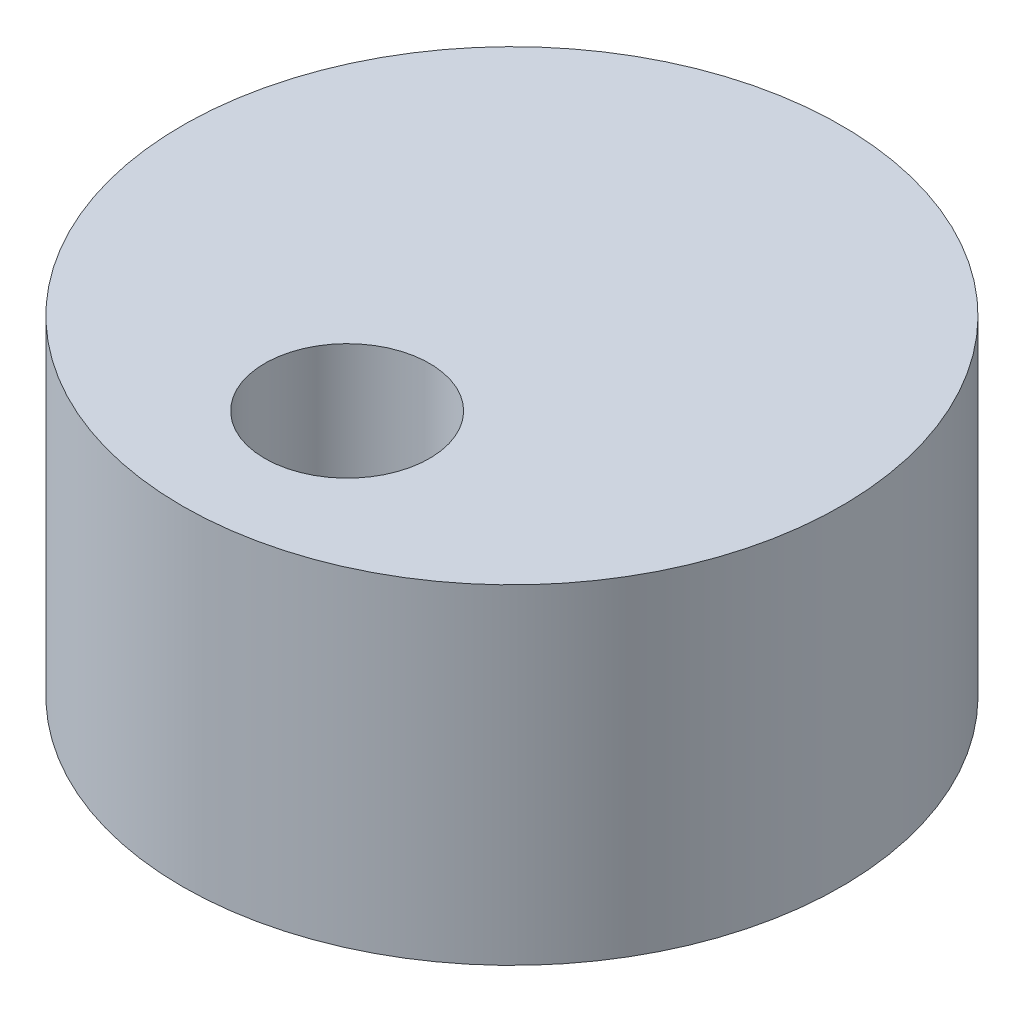
from build123d import *

# Parameters (mm, degrees)
SKETCH1_R           = 6.35
SKETCH1_R_2         = 1.5875
BOSS_EXTRUDE1_DEPTH = 6.35


with BuildPart() as part:
    # Sketch1 → Boss-Extrude1 (new body)
    with BuildSketch(Plane(origin=(0, 0, 0), x_dir=(1, 0, 0), z_dir=(0, 1, 0))):
        Circle(SKETCH1_R)
        with Locations((0, -3.175)):
            Circle(SKETCH1_R_2, mode=Mode.SUBTRACT)
    extrude(amount=BOSS_EXTRUDE1_DEPTH)


solid = part.part
